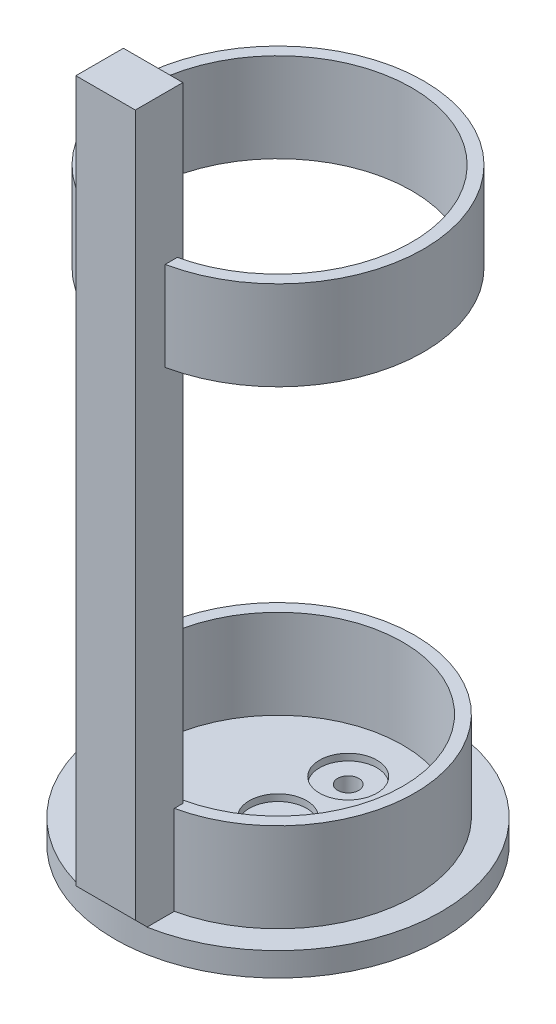
from build123d import *

# Parameters (mm, degrees)
SKETCH1_R                 = 34.925
BOSS_EXTRUDE1_DEPTH       = 5.08
SKETCH3_W                 = 12.7
SKETCH3_H                 = 10.16
BOSS_EXTRUDE2_DEPTH       = 152.4
SKETCH4_R                 = 29.21
SKETCH4_R_2               = 26.67
EXTRUDE_THIN1_DEPTH       = 19.05
ADVANCEDHOLE3_START       = 3.65
ADVANCEDHOLE3_OUTLINE_R   = 6.12
ADVANCEDHOLE3_DEPTH       = 1.43
ADVANCEDHOLE3_2_OUTLINE_R = 2.25
ADVANCEDHOLE3_2_DEPTH     = 3.65
CHAMFER1_SIZE             = 2.54
SKETCH14_R                = 31.115
SKETCH14_R_2              = 28.575
EXTRUDE_THIN3_DEPTH       = 19.05


# Read off the part's stored shape, not the designer's step: AdvancedHole3
with BuildPart() as part:
    # Sketch1 → Boss-Extrude1 (new body)
    with BuildSketch(Plane(origin=(0, 0, 0), x_dir=(1, 0, 0), z_dir=(0, 1, 0))):
        with Locations(Location((0, 0, 0), (0, 0, 270))):
            Circle(SKETCH1_R)
    extrude(amount=BOSS_EXTRUDE1_DEPTH)

    # Sketch3 → Boss-Extrude2 (add)
    with BuildSketch(Plane(origin=(0, 5.08, 0), x_dir=(1, 0, 0), z_dir=(0, 1, 0))):
        with Locations((0, -31.75)):
            Rectangle(SKETCH3_W, SKETCH3_H)
    extrude(amount=BOSS_EXTRUDE2_DEPTH)

    # Sketch4 → Extrude-Thin1 (add)
    with BuildSketch(Plane(origin=(0, 5.08, 0), x_dir=(1, 0, 0), z_dir=(0, 1, 0))):
        Circle(SKETCH4_R)
        Circle(SKETCH4_R_2, mode=Mode.SUBTRACT)
    extrude(amount=EXTRUDE_THIN1_DEPTH)

    # AdvancedHole3 outline → AdvancedHole3 (cut)
    with BuildSketch(Plane(origin=(0, 0, 0), x_dir=(1, 0, 0), z_dir=(0, 1, 0)).offset(ADVANCEDHOLE3_START)):
        with Locations((0, 15)):
            Circle(ADVANCEDHOLE3_OUTLINE_R)
        with Locations((0, -15)):
            Circle(ADVANCEDHOLE3_OUTLINE_R)
        Circle(ADVANCEDHOLE3_OUTLINE_R)
    extrude(amount=ADVANCEDHOLE3_DEPTH, mode=Mode.SUBTRACT)

    # AdvancedHole3 2 outline → AdvancedHole3 2 (cut)
    with BuildSketch(Plane(origin=(0, 0, 0), x_dir=(1, 0, 0), z_dir=(0, 1, 0))):
        with Locations((0, 15)):
            Circle(ADVANCEDHOLE3_2_OUTLINE_R)
        with Locations((0, -15)):
            Circle(ADVANCEDHOLE3_2_OUTLINE_R)
        Circle(ADVANCEDHOLE3_2_OUTLINE_R)
    extrude(amount=ADVANCEDHOLE3_2_DEPTH, mode=Mode.SUBTRACT)

    # Chamfer1
    # the kernel refuses this chamfer: 2.54 mm, written as the material it takes off along each edge
    with BuildSketch(Plane(origin=(12.882074789, 5.08, 36.83), x_dir=(0, -0.02749587661058625, -0.9996219169112968), z_dir=(-1, 0, 0))) as chamfer1_piece_1_section:
        Polygon((CHAMFER1_SIZE * 0.999621916911, -CHAMFER1_SIZE * 0.0274958766106), (-CHAMFER1_SIZE * 0.0274958766106, -CHAMFER1_SIZE * 0.999621916911), (0, 0), align=None)
    chamfer1_piece_1 = extrude(amount=25.764149579, mode=Mode.PRIVATE)
    chamfer1_piece_1 = chamfer1_piece_1 - Plane(origin=(0, 5.934504944, 0), x_dir=(0, 0, 1), z_dir=(0, -1, 0)) * Cylinder(34.925, 62, mode=Mode.PRIVATE)
    add(chamfer1_piece_1, mode=Mode.SUBTRACT)

    # Sketch14 → Extrude-Thin3 (add)
    with BuildSketch(Plane.ZX.offset(106.68)):
        Circle(SKETCH14_R)
        Circle(SKETCH14_R_2, mode=Mode.SUBTRACT)
    extrude(amount=EXTRUDE_THIN3_DEPTH)


solid = part.part
